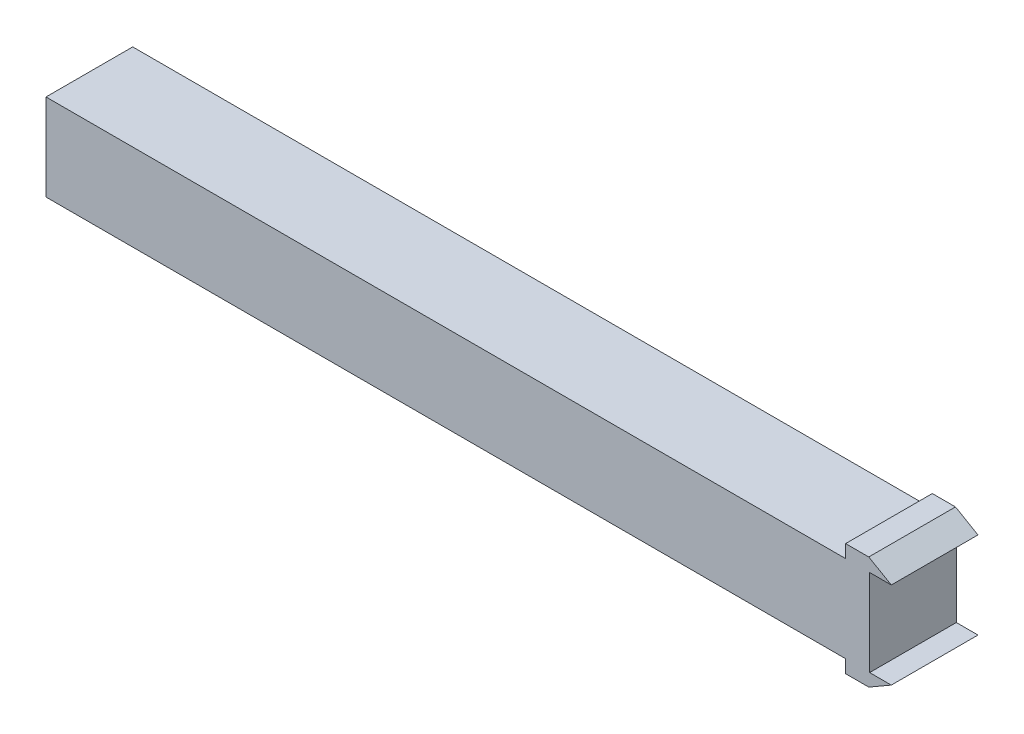
from build123d import *

# Parameters (mm, degrees)
SKETCH1_W            = 190
SKETCH1_H            = 20
BOSS_EXTRUDE1_DEPTH  = 20
BOSS_EXTRUDE2_DEPTH  = 10
MIRROR2_COPY_1_DEPTH = 10
MIRROR2_COPY_2_DEPTH = 10


with BuildPart() as part:
    # Sketch1 → Boss-Extrude1 (new body)
    with BuildSketch(Plane.XY):
        Rectangle(SKETCH1_W, SKETCH1_H)
    extrude(amount=BOSS_EXTRUDE1_DEPTH)

    # Sketch2 → Boss-Extrude2 (add)
    with BuildSketch(Plane.XY.offset(20)):
        Polygon((89.457257732, 10), (89.457257732, 13), (94.803847577, 13), (100, 10), (95, 10), align=None)
    boss_extrude2 = extrude(amount=-BOSS_EXTRUDE2_DEPTH)

    # Mirror1: Boss-Extrude2 across plane
    add(boss_extrude2.mirror(Plane.ZX))

    # Mirror2 copy 1 sketch → Mirror2 copy 1 (add)
    with BuildSketch(Plane(origin=(0, 0, 0), x_dir=(1, 0, 0), z_dir=(0, 0, -1))):
        Polygon((89.457257732, 10), (89.457257732, 13), (94.803847577, 13), (100, 10), (95, 10), align=None)
    extrude(amount=-MIRROR2_COPY_1_DEPTH)

    # Mirror2 copy 2 sketch → Mirror2 copy 2 (add)
    with BuildSketch(Plane(origin=(0, 0, 0), x_dir=(1, 0, 0), z_dir=(0, 0, -1))):
        Polygon((89.457257732, -10), (89.457257732, -13), (94.803847577, -13), (100, -10), (95, -10), align=None)
    extrude(amount=-MIRROR2_COPY_2_DEPTH)


solid = part.part
